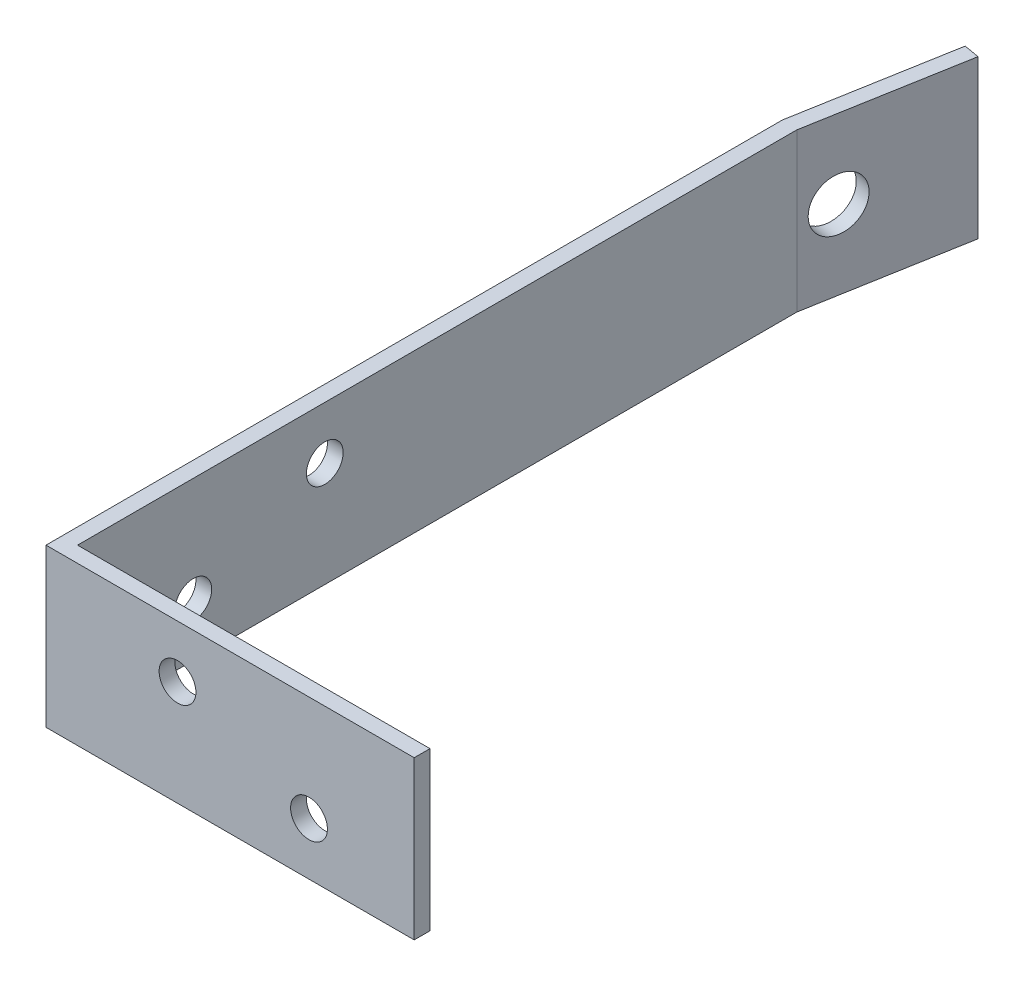
from build123d import *

# Parameters (mm, degrees)
EXTRUDE_1_DEPTH     = 30
SKETCH_2_R          = 3.5
CUT_EXTRUDE_1_DEPTH = 186.863516605
SKETCH_3_R          = 3.5
CUT_EXTRUDE_2_DEPTH = 186.863516605
SKETCH_4_R          = 5
CUT_EXTRUDE_3_DEPTH = 193.500880412


with BuildPart() as part:
    # Эскиз1 → Вытянуть-Тонкостенный1 (new body)
    with BuildSketch(Plane(origin=(0, 0, 0), x_dir=(1, 0, 0), z_dir=(0, 1, 0))):
        Polygon((5.20944533, 169.54423259), (0, 140), (0, 0), (70, 0), (70, 3), (3, 3), (3, 139.737534009), (8.163868589, 169.023288057), align=None)
    extrude(amount=EXTRUDE_1_DEPTH)

    # Эскиз2 → Вырез-Вытянуть1 (cut, through all)
    with BuildSketch(Plane.ZY):
        with Locations((-50, 20)):
            Circle(SKETCH_2_R)
        with Locations((-25, 10)):
            Circle(SKETCH_2_R)
    extrude(amount=-CUT_EXTRUDE_1_DEPTH, mode=Mode.SUBTRACT)

    # Эскиз3 → Вырез-Вытянуть2 (cut, through all)
    with BuildSketch(Plane.XY):
        with Locations((25, 20)):
            Circle(SKETCH_3_R)
        with Locations((50, 10)):
            Circle(SKETCH_3_R)
    extrude(amount=-CUT_EXTRUDE_2_DEPTH, mode=Mode.SUBTRACT)

    # Эскиз4 → Вырез-Вытянуть3 (cut, through all)
    with BuildSketch(Plane(origin=(-23.941410033, 0, -4.221516545), x_dir=(-0.17364817766691243, 0, 0.9848077530122112), z_dir=(-0.9848077530122112, 0, -0.17364817766691243))):
        with Locations((-145, 15)):
            Circle(SKETCH_4_R)
    extrude(amount=-CUT_EXTRUDE_3_DEPTH, mode=Mode.SUBTRACT)


solid = part.part
